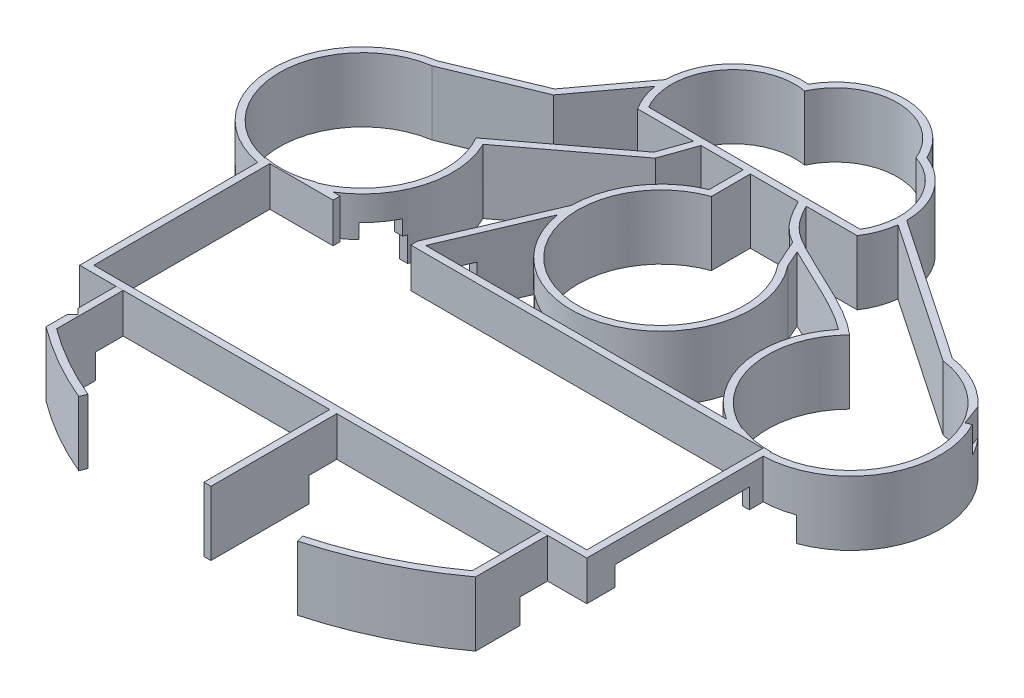
from build123d import *

# Parameters (mm, degrees)
EXTRUDE_THIN_START                         = 31.4
EXTRUDE_THIN_LIGHT_SEPARATORS_DEPTH        = 9.1
EXTRUDE_THIN_LIGHT_SEPARATORS_2_DEPTH      = 9.1
EXTRUDE_THIN_LIGHT_SEPARATORS_3_DEPTH      = 9.1
EXTRUDE_THIN_LIGHT_SEPARATORS_4_OUTLINE_W  = 1
EXTRUDE_THIN_LIGHT_SEPARATORS_4_OUTLINE_H  = 17.799646299
EXTRUDE_THIN_LIGHT_SEPARATORS_4_DEPTH      = 9.1
EXTRUDE_THIN_START_2                       = -10.3
LCD_AREA_W                                 = 71.75
LCD_AREA_H                                 = 26.9
LCD_AREA_W_2                               = 69.75
LCD_AREA_H_2                               = 24.9
EXTRUDE_THIN_LCD_CASING_DEPTH              = 9.3
CUT_EXTRUDE_START                          = 31.2
ICON_CIRCLES_R                             = 11.65
CUT_EXTRUDE_ICON_CIRCLES_DEPTH             = 9.3
CUT_EXTRUDE_START_2                        = -10.1
CUT_EXTRUDE_LCD_CASING_DEPTH               = 10.1
CUT_EXTRUDE_THIN_START                     = 31.2
CUT_EXTRUDE_THIN_LIGHT_PIPE_OPENING_OUTL_W = 11
CUT_EXTRUDE_THIN_LIGHT_PIPE_OPENING_OUTL_H = 1
CUT_EXTRUDE_THIN_LIGHT_PIPE_OPENING_DEPTH  = 9.8
CUT_EXTRUDE_START_3                        = -6.6
LCD_AREA_4_R                               = 1.5
LCD_AREA_4_W                               = 41
LCD_AREA_4_H                               = 3.5
LCD_AREA_4_W_2                             = 4.95
LCD_AREA_4_H_2                             = 19
LCD_AREA_4_W_3                             = 69.75
LCD_AREA_4_H_3                             = 24.9
CUT_EXTRUDE_LCD_PCB_DEPTH                  = 64.22192805
CUT_EXTRUDE_LCD_HEADER_DEPTH               = 2.1
CUT_EXTRUDE_LCD_HEADER_DEPTH_BACK          = 70.792704767
CUT_EXTRUDE_LCD_HEADER_START               = -6.6
LCD_AREA_2_W                               = 41
LCD_AREA_2_H                               = 3.5
LCD_AREA_3_W                               = 4.95
LCD_AREA_3_H                               = 19
CUT_EXTRUDE_LCD_BACKLIGHT_DEPTH            = 2.8
CUT_EXTRUDE_START_4                        = 36.7
CUT_EXTRUDE_LOCKING_SLIDE_CLEARANCE_DEPTH  = 3.8


with BuildPart() as part:
    # Extrude-Thin light separators: read off the stored shape, not the designer's step
    # Extrude-Thin light separators outline → Extrude-Thin light separators (new body)
    with BuildSketch(Plane(origin=(0, 0, 0), x_dir=(1, 0, 0), z_dir=(0, 1, 0)).offset(EXTRUDE_THIN_START)):
        with BuildLine():
            Line((-14.298683133, -5.295611284), (-8.223485051, 8.995438143))
            ThreePointArc((-8.223485051, 8.995438143), (9.540830765, -0.593944441), (14.314786845, 19.02075714))
            Line((14.314786845, 19.02075714), (13.254362874, 21.39798101))
            add(Edge.make_bspline(
                [(25.702631963, 14.820308191), (24.216946457, 15.951441539), (22.329516053, 16.99925946), (18.41355894, 18.950247216), (16.385500993, 19.854914549), (14.136088219, 20.948653176), (13.683921835, 21.174158171), (13.254362874, 21.39798101)],
                knots=[0, 0, 0, 0, 0.25, 0.25, 0.5, 0.5, 0.565921603, 0.565921603, 0.565921603, 0.565921603], degree=3))
            ThreePointArc((25.702631963, 14.820308191), (40.148012294, -5.185202508), (37.305049482, 19.32616289))
            Line((37.305049482, 19.32616289), (17.154098173, 33.005818362))
            ThreePointArc((17.154098173, 33.005818362), (15.441684184, 38.537902927), (10.893759088, 42.122968984))
            ThreePointArc((10.893759088, 42.122968984), (2.389878349, 47.757628458), (-6.483749503, 42.725322451))
            ThreePointArc((-6.483749503, 42.725322451), (-13.902676881, 40.287358224), (-17.152665019, 33.186532207))
            Line((-17.152665019, 33.186532207), (-23.849643876, 24.194703114))
            Line((-23.849643876, 24.194703114), (-35.606423373, 19.338157404))
            ThreePointArc((-35.606423373, 19.338157404), (-39.44771187, -4.570277033), (-22.12893879, 12.353931473))
            Line((-22.12893879, 12.353931473), (-8.246686201, 22.846993345))
            Line((-8.246686201, 22.846993345), (-6.563109586, 27.623480552))
            Line((-6.563109586, 27.623480552), (-0.590812065, 27.623480552))
            Line((-0.590812065, 27.623480552), (-0.590812065, 22.805539859))
            ThreePointArc((-0.590812065, 22.805539859), (-6.234932014, 18.150031239), (-8.390606103, 11.158399117))
            Line((-8.390606103, 11.158399117), (-15.218979228, -4.904388716))
            Line((-15.218979228, -4.904388716), (-14.298683133, -5.295611284))
        make_face()
        with BuildLine():
            ThreePointArc((-23.412620345, 12.6371716), (-38.672251757, -3.8398793), (-35.334668261, 18.368454577))
            Line((-35.334668261, 18.368454577), (-23.212602198, 23.375894579))
            Line((-23.212602198, 23.375894579), (-17.056356752, 31.641697424))
            ThreePointArc((-17.056356752, 31.641697424), (-16.515066225, 29.547126946), (-15.525214989, 27.623480552))
            Line((-15.525214989, 27.623480552), (-7.623409688, 27.623480552))
            Line((-7.623409688, 27.623480552), (-9.089767532, 23.463266268))
            Line((-9.089767532, 23.463266268), (-23.412620345, 12.6371716))
        make_face(mode=Mode.SUBTRACT)
        with BuildLine():
            Line((0.409187935, 27.623480552), (7.186713048, 27.623480561))
            add(Edge.make_bspline(
                [(11.797795269, 22.20857309), (11.218397358, 22.558383177), (10.703539968, 22.91413691), (9.650987033, 23.824495711), (9.133669557, 24.403406231), (8.156922087, 25.812491531), (7.694528576, 26.617562345), (7.186713048, 27.623480561)],
                knots=[0.646043859, 0.646043859, 0.646043859, 0.646043859, 0.75, 0.75, 0.875, 0.875, 0.989625954, 0.989625954, 0.989625954, 0.989625954], degree=3))
            Line((11.797795269, 22.20857309), (13.454878311, 18.493778378))
            ThreePointArc((13.454878311, 18.493778378), (1.210767354, -0.264833168), (0.409187935, 22.121797456))
            Line((0.409187935, 22.121797456), (0.409187935, 27.623480552))
        make_face(mode=Mode.SUBTRACT)
        with BuildLine():
            Line((8.311174787, 27.623480552), (15.525214989, 27.623480552))
            ThreePointArc((15.525214989, 27.623480552), (16.551121322, 29.643265667), (17.083219668, 31.845284528))
            Line((17.083219668, 31.845284528), (36.939907611, 18.365386581))
            ThreePointArc((36.939907611, 18.365386581), (39.415706775, -4.389722121), (27.154753078, 14.938846579))
            add(Edge.make_bspline(
                [(27.154753078, 14.938846579), (27.059504743, 15.016359981), (26.964256407, 15.093873384), (26.821383904, 15.210143488), (26.774979873, 15.247979823), (26.676483406, 15.327970245), (26.428156364, 15.527192692), (26.169678348, 15.722726623), (25.531944452, 16.185444075), (25.083605568, 16.485187994), (23.685729547, 17.361573645), (22.683263666, 17.915486311), (19.598976222, 19.505593072), (17.439101335, 20.470872135), (14.60086106, 21.829468577), (13.721865339, 22.267390878), (12.578167945, 22.903955228), (12.227976031, 23.111141371), (11.58909897, 23.526419272), (11.298366651, 23.736040455), (10.479836455, 24.410411056), (10.002943174, 24.920682697), (9.12885589, 26.154986738), (8.738434889, 26.808514556), (8.311174787, 27.623480552)],
                knots=[0, 0, 0, 0, 0.015625, 0.015625, 0.0234375, 0.0234375, 0.03125, 0.0625, 0.0625, 0.125, 0.125, 0.25, 0.25, 0.5, 0.5, 0.625, 0.625, 0.6875, 0.6875, 0.75, 0.75, 0.875, 0.875, 0.972704695, 0.972704695, 0.972704695, 0.972704695], degree=3))
        make_face(mode=Mode.SUBTRACT)
        with BuildLine():
            ThreePointArc((10.150604153, 41.326641173), (15.585125309, 36.122636477), (14.970027367, 28.623480552))
            Line((14.970027367, 28.623480552), (-14.970027367, 28.623480552))
            ThreePointArc((-14.970027367, 28.623480552), (-14.586001283, 38.017147512), (-5.910754966, 41.640482487))
            ThreePointArc((-5.910754966, 41.640482487), (2.223062349, 46.761810579), (10.150604153, 41.326641173))
        make_face(mode=Mode.SUBTRACT)
    extrude(amount=EXTRUDE_THIN_LIGHT_SEPARATORS_DEPTH)



with BuildPart() as body_2:
    # Extrude-Thin light separators 2 outline → Extrude-Thin light separators 2 (new body)
    with BuildSketch(Plane(origin=(0, 0, 0), x_dir=(1, 0, 0), z_dir=(0, 1, 0)).offset(EXTRUDE_THIN_START)):
        with BuildLine():
            ThreePointArc((13.359579626, -49.374361681), (22.234582877, -46.064403648), (30.347091119, -41.174749784))
            Line((30.347091119, -41.174749784), (30.347091119, -31))
            Line((30.347091119, -31), (29.347091119, -31))
            Line((29.347091119, -31), (29.347091119, -40.666380776))
            ThreePointArc((29.347091119, -40.666380776), (21.572949076, -45.272664498), (13.098394447, -48.409072966))
            Line((13.098394447, -48.409072966), (13.359579626, -49.374361681))
        make_face()
    extrude(amount=EXTRUDE_THIN_LIGHT_SEPARATORS_2_DEPTH)


with BuildPart() as body_3:
    # Extrude-Thin light separators 3 outline → Extrude-Thin light separators 3 (new body)
    with BuildSketch(Plane(origin=(0, 0, 0), x_dir=(1, 0, 0), z_dir=(0, 1, 0)).offset(EXTRUDE_THIN_START)):
        with BuildLine():
            ThreePointArc((-19.444112848, -46.226970029), (-24.739453019, -43.62299562), (-29.692265151, -40.415042655))
            Line((-29.692265151, -40.415042655), (-29.692265151, -31))
            Line((-29.692265151, -31), (-30.692265151, -31))
            Line((-30.692265151, -31), (-30.692265151, -40.918098918))
            ThreePointArc((-30.692265151, -40.918098918), (-25.453415736, -44.366987576), (-19.831833198, -47.148747079))
            Line((-19.831833198, -47.148747079), (-19.444112848, -46.226970029))
        make_face()
    extrude(amount=EXTRUDE_THIN_LIGHT_SEPARATORS_3_DEPTH)


with BuildPart() as body_4:
    # Extrude-Thin light separators 4 outline → Extrude-Thin light separators 4 (new body)
    with BuildSketch(Plane(origin=(0, 0, 0), x_dir=(1, 0, 0), z_dir=(0, 1, 0)).offset(EXTRUDE_THIN_START)):
        with Locations((0.025, -39.89982315)):
            Rectangle(EXTRUDE_THIN_LIGHT_SEPARATORS_4_OUTLINE_W, EXTRUDE_THIN_LIGHT_SEPARATORS_4_OUTLINE_H)
    extrude(amount=EXTRUDE_THIN_LIGHT_SEPARATORS_4_DEPTH)


with BuildPart() as part_1:
    add(part.part)

    add(body_4.part)  # Extrude-Thin LCD casing merges body 4
    # LCD area → Extrude-Thin LCD casing (add)
    with BuildSketch(Plane(origin=(0, 41.5, 0), x_dir=(1, 0, 0), z_dir=(0, 1, 0)).offset(EXTRUDE_THIN_START_2)):
        with Locations((0.025, -17.55)):
            Rectangle(LCD_AREA_W, LCD_AREA_H)
        with Locations((0.025, -17.55)):
            Rectangle(LCD_AREA_W_2, LCD_AREA_H_2, mode=Mode.SUBTRACT)
    extrude(amount=EXTRUDE_THIN_LCD_CASING_DEPTH)

    # Icon circles → Cut-Extrude icon circles (cut)
    with BuildSketch(Plane(origin=(0, 0, 0), x_dir=(1, 0, 0), z_dir=(0, 1, 0)).offset(CUT_EXTRUDE_START)):
        with Locations((-33.58138185, 6.75)):
            Circle(ICON_CIRCLES_R)
        with Locations((35.532336683, 6.7)):
            Circle(ICON_CIRCLES_R)
    extrude(amount=CUT_EXTRUDE_ICON_CIRCLES_DEPTH, mode=Mode.SUBTRACT)

    # Cut-Extrude LCD casing: read off the stored shape, not the designer's step
    # Cut-Extrude LCD casing outline → Cut-Extrude LCD casing (cut)
    with BuildSketch(Plane(origin=(0, 41.5, 0), x_dir=(1, 0, 0), z_dir=(0, 1, 0)).offset(CUT_EXTRUDE_START_2)):
        with BuildLine():
            ThreePointArc((-34.85, -5.936729602), (-31.812836578, -5.87674731), (-28.876065708, -5.1))
            Line((-28.876065708, -5.1), (-34.85, -5.1))
            Line((-34.85, -5.1), (-34.85, -5.936729602))
        make_face()
        Polygon((-14.298683133, -5.295611284), (-14.215527777, -5.1), (-14.75883118, -5.1), align=None)
        with BuildLine():
            Line((34.9, -5.1), (30.702999254, -5.1))
            ThreePointArc((30.702999254, -5.1), (32.761830447, -5.745352353), (34.9, -6.034309966))
            Line((34.9, -6.034309966), (34.9, -5.1))
        make_face()
    extrude(amount=CUT_EXTRUDE_LCD_CASING_DEPTH, mode=Mode.SUBTRACT)

    # Cut-Extrude-Thin light pipe opening: read off the stored shape, not the designer's step
    # Cut-Extrude-Thin light pipe opening outl → Cut-Extrude-Thin light pipe opening (cut)
    with BuildSketch(Plane(origin=(0, 0, 0), x_dir=(1, 0, 0), z_dir=(0, 1, 0)).offset(CUT_EXTRUDE_THIN_START)):
        with Locations((-20.400616712, -4.6)):
            Rectangle(CUT_EXTRUDE_THIN_LIGHT_PIPE_OPENING_OUTL_W, CUT_EXTRUDE_THIN_LIGHT_PIPE_OPENING_OUTL_H)
    extrude(amount=CUT_EXTRUDE_THIN_LIGHT_PIPE_OPENING_DEPTH, mode=Mode.SUBTRACT)


with BuildPart() as cut_extrude_lcd_pcb_tool:
    # LCD area<4> → Cut-Extrude LCD PCB (new, through all)
    # profile 1 of 8: a face of its own
    with BuildSketch(Plane(origin=(0, 41.5, 0), x_dir=(1, 0, 0), z_dir=(0, 1, 0)).offset(CUT_EXTRUDE_START_3)):
        Polygon((39.85, 1.5), (-40.55, 1.5), (-40.55, -34.9), (39.85, -34.9), (39.85, -27), (34.9, -27), (34.9, -30), (-34.85, -30), (-34.85, -5.1), (34.9, -5.1), (34.9, -8), (39.85, -8), align=None)
        with Locations((-37.85, -32.2)):
            Circle(LCD_AREA_4_R, mode=Mode.SUBTRACT)
        with Locations((37.15, -32.2)):
            Circle(LCD_AREA_4_R, mode=Mode.SUBTRACT)
        with Locations((-37.85, -1.2)):
            Circle(LCD_AREA_4_R, mode=Mode.SUBTRACT)
        with Locations((-13.25, -0.75)):
            Rectangle(LCD_AREA_4_W, LCD_AREA_4_H, mode=Mode.SUBTRACT)
        with Locations((37.15, -1.2)):
            Circle(LCD_AREA_4_R, mode=Mode.SUBTRACT)
    # profile 2 of 8: a face of its own
    with BuildSketch(Plane(origin=(0, 41.5, 0), x_dir=(1, 0, 0), z_dir=(0, 1, 0)).offset(CUT_EXTRUDE_START_3)):
        with Locations((37.15, -32.2)):
            Circle(LCD_AREA_4_R)
    # profile 3 of 8: a face of its own
    with BuildSketch(Plane(origin=(0, 41.5, 0), x_dir=(1, 0, 0), z_dir=(0, 1, 0)).offset(CUT_EXTRUDE_START_3)):
        with Locations((37.15, -1.2)):
            Circle(LCD_AREA_4_R)
    # profile 4 of 8: a face of its own
    with BuildSketch(Plane(origin=(0, 41.5, 0), x_dir=(1, 0, 0), z_dir=(0, 1, 0)).offset(CUT_EXTRUDE_START_3)):
        with Locations((-37.85, -1.2)):
            Circle(LCD_AREA_4_R)
    # profile 5 of 8: a face of its own
    with BuildSketch(Plane(origin=(0, 41.5, 0), x_dir=(1, 0, 0), z_dir=(0, 1, 0)).offset(CUT_EXTRUDE_START_3)):
        with Locations((-37.85, -32.2)):
            Circle(LCD_AREA_4_R)
    # profile 6 of 8: a face of its own
    with BuildSketch(Plane(origin=(0, 41.5, 0), x_dir=(1, 0, 0), z_dir=(0, 1, 0)).offset(CUT_EXTRUDE_START_3)):
        with Locations((37.375, -17.5)):
            Rectangle(LCD_AREA_4_W_2, LCD_AREA_4_H_2)
    # profile 7 of 8: a face of its own
    with BuildSketch(Plane(origin=(0, 41.5, 0), x_dir=(1, 0, 0), z_dir=(0, 1, 0)).offset(CUT_EXTRUDE_START_3)):
        with Locations((0.025, -17.55)):
            Rectangle(LCD_AREA_4_W_3, LCD_AREA_4_H_3)
        with BuildLine():
            ThreePointArc((-31.1, -9.35), (-32.160660172, -9.789339828), (-32.6, -10.85))
            Line((-32.6, -10.85), (-32.6, -24.15))
            ThreePointArc((-32.6, -24.15), (-32.160660172, -25.210660172), (-31.1, -25.65))
            Line((-31.1, -25.65), (31.1, -25.65))
            ThreePointArc((31.1, -25.65), (32.160660172, -25.210660172), (32.6, -24.15))
            Line((32.6, -24.15), (32.6, -10.85))
            ThreePointArc((32.6, -10.85), (32.160660172, -9.789339828), (31.1, -9.35))
            Line((31.1, -9.35), (-31.1, -9.35))
        make_face(mode=Mode.SUBTRACT)
    # profile 8 of 8: a face of its own
    with BuildSketch(Plane(origin=(0, 41.5, 0), x_dir=(1, 0, 0), z_dir=(0, 1, 0)).offset(CUT_EXTRUDE_START_3)):
        with Locations((37.375, -17.5)):
            Rectangle(LCD_AREA_4_W_2, LCD_AREA_4_H_2)
    extrude(amount=-CUT_EXTRUDE_LCD_PCB_DEPTH)


with BuildPart() as part_2:
    add(part_1.part)

    # Cut-Extrude LCD PCB: cut by cut_extrude_lcd_pcb_tool
    add(cut_extrude_lcd_pcb_tool.part, mode=Mode.SUBTRACT)

    # LCD area<2> → Cut-Extrude LCD header (cut, two sides: drawn at the far end of the back side and taken through both)
    with BuildSketch(Plane(origin=(0, 41.5, 0), x_dir=(1, 0, 0), z_dir=(0, 1, 0)).offset(CUT_EXTRUDE_LCD_HEADER_START - CUT_EXTRUDE_LCD_HEADER_DEPTH_BACK)):
        with Locations((-13.25, -0.75)):
            Rectangle(LCD_AREA_2_W, LCD_AREA_2_H)
    extrude(amount=CUT_EXTRUDE_LCD_HEADER_DEPTH + CUT_EXTRUDE_LCD_HEADER_DEPTH_BACK, mode=Mode.SUBTRACT)

    # LCD area_3 → Cut-Extrude LCD backlight (cut)
    with BuildSketch(Plane(origin=(0, 41.5, 0), x_dir=(1, 0, 0), z_dir=(0, 1, 0)).offset(CUT_EXTRUDE_START_3)):
        with Locations((37.375, -17.5)):
            Rectangle(LCD_AREA_3_W, LCD_AREA_3_H)
    extrude(amount=CUT_EXTRUDE_LCD_BACKLIGHT_DEPTH, mode=Mode.SUBTRACT)


with BuildPart() as body_2_1:
    add(body_2.part)

    # Cut-Extrude LCD PCB: cut by cut_extrude_lcd_pcb_tool
    add(cut_extrude_lcd_pcb_tool.part, mode=Mode.SUBTRACT)


with BuildPart() as body_3_1:
    add(body_3.part)

    # Cut-Extrude LCD PCB: cut by cut_extrude_lcd_pcb_tool
    add(cut_extrude_lcd_pcb_tool.part, mode=Mode.SUBTRACT)


with BuildPart() as cut_extrude_locking_slide_clearance_tool:
    # Locking slide clearance → Cut-Extrude locking slide clearance (new body)
    with BuildSketch(Plane(origin=(0, 0, 0), x_dir=(1, 0, 0), z_dir=(0, 1, 0)).offset(CUT_EXTRUDE_START_4)):
        Polygon((-47.698248446, 0.222699782), (-46.864390399, 8.882646708), (-52.569951783, 9.432029783), (-53.40380983, 0.772082857), align=None)
        Polygon((-32.693092125, 42.234165597), (-29.565257772, 37.430843336), (-22.27473664, 42.178295456), (-25.402570993, 46.981617717), align=None)
        Polygon((12.636190768, 51.893060222), (10.830975026, 46.452798409), (19.08824813, 43.712827446), (20.893463873, 49.153089259), align=None)
        Polygon((48.450164281, 22.475422075), (43.071262717, 20.494848815), (46.077392729, 12.33070879), (51.456294294, 14.31128205), align=None)
        Polygon((47.780175888, -23.86666731), (42.878011089, -20.896139955), (38.369320796, -28.336685086), (43.271485594, -31.30721244), align=None)
        Polygon((11.130740513, -52.236669419), (10.396742559, -46.551909136), (1.768367712, -47.665977129), (2.502365665, -53.350737412), align=None)
        Polygon((-33.900369494, -41.271394022), (-29.913485173, -37.153141251), (-36.164202328, -31.101816185), (-40.151086649, -35.220068956), align=None)
    extrude(amount=CUT_EXTRUDE_LOCKING_SLIDE_CLEARANCE_DEPTH)


with BuildPart() as part_3:
    add(part_2.part)

    # Cut-Extrude locking slide clearance: cut by cut_extrude_locking_slide_clearance_tool
    add(cut_extrude_locking_slide_clearance_tool.part, mode=Mode.SUBTRACT)


with BuildPart() as body_3_2:
    add(body_3_1.part)

    # Cut-Extrude locking slide clearance: cut by cut_extrude_locking_slide_clearance_tool
    add(cut_extrude_locking_slide_clearance_tool.part, mode=Mode.SUBTRACT)


solid = Compound([body_2_1.part, part_3.part, body_3_2.part])
